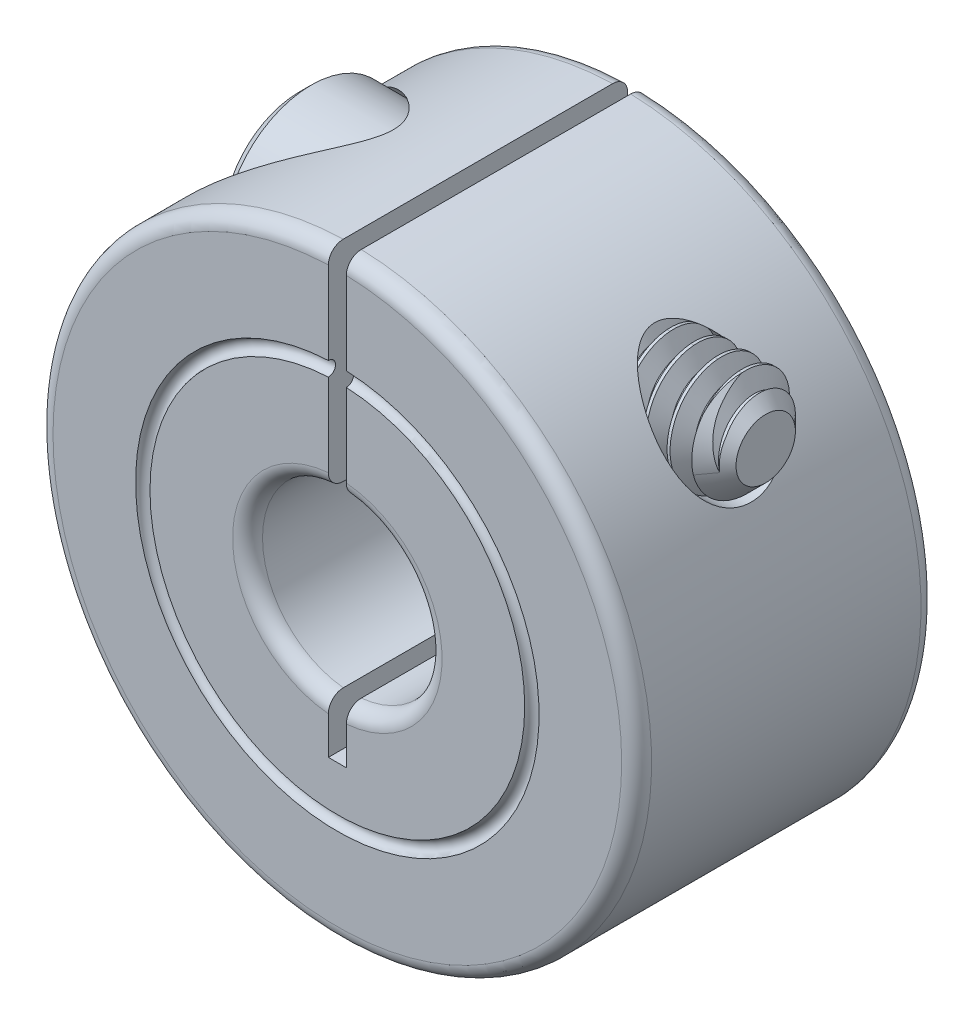
from build123d import *

# Parameters (mm, degrees)
EXTRUDE1_DEPTH     = 3.96875
FILLET1_R          = 0.396875
CUT_EXTRUDE1_DEPTH = 2.38125
CHAMFER1_SIZE      = 0.3175
CHAMFER2_SIZE      = 0.635
CUT_SWEEP1_PITCH   = 0.635


with BuildPart() as part:
    # Sketch1 → Extrude1 (new, symmetric)
    with BuildSketch(Plane.XY):
        with BuildLine():
            Line((-0.238125, 2.369313835), (-0.238125, 7.933927321))
            ThreePointArc((-0.238125, 7.933927321), (0, -7.9375), (0.238125, 7.933927321))
            Line((0.238125, 7.933927321), (0.238125, 2.369313835))
            ThreePointArc((0.238125, 2.369313835), (2.38125, 0), (0.238125, -2.369313835))
            Line((0.238125, -2.369313835), (0.238125, -3.7703125))
            Line((0.238125, -3.7703125), (-0.238125, -3.7703125))
            Line((-0.238125, -3.7703125), (-0.238125, -2.369313835))
            ThreePointArc((-0.238125, -2.369313835), (-2.38125, 0), (-0.238125, 2.369313835))
        make_face()
    extrude(amount=EXTRUDE1_DEPTH, both=True)

    # Fillet1
    fillet1_edges = [part.edges().sort_by_distance(p)[0] for p in [
        (-2.38125, 0, 3.96875),
        (0, -7.9375, 3.96875),
        (2.38125, 0, 3.96875),
        (2.38125, 0, -3.96875),
        (0, -7.9375, -3.96875),
        (-2.38125, 0, -3.96875),
    ]]
    fillet(fillet1_edges, radius=FILLET1_R)

    # Sketch2 → Cut-Revolve1 (revolve, cut)
    with BuildSketch(Plane(origin=(0, 0, 0), x_dir=(1, 0, 0), z_dir=(0, 1, 0))):
        with BuildLine():
            Line((-5.349875, -3.96875), (-4.968875, -3.96875))
            ThreePointArc((-4.968875, -3.96875), (-5.159375, -3.77825), (-5.349875, -3.96875))
        make_face()
    revolve(axis=Axis((0, 0, -3.96875), (0, 0, 1)), mode=Mode.SUBTRACT)

    # Sketch3 → Cut-Revolve2 (revolve, cut)
    with BuildSketch(Plane.XY, mode=Mode.PRIVATE) as cut_revolve2_sk:
        Polygon((7.9375, 5.151620578), (-7.9375, 5.151620578), (-7.9375, 2.764020578), (-2.1336, 2.764020578), (-2.1336, 3.729220578), (7.9375, 3.729220578), align=None)
    revolve(cut_revolve2_sk.sketch.rotate(Axis((-7.9375, 5.151620578, 0), (-1, 0, 0)), 180), axis=Axis((-7.9375, 5.151620578, 0), (-1, 0, 0)), mode=Mode.SUBTRACT)


with BuildPart() as body_2:
    # Sketch4 → Revolve1 (revolve)
    with BuildSketch(Plane.XY):
        Polygon((-4.9784, 5.151620578), (-4.9784, 7.475720578), (-2.1336, 7.475720578), (-2.1336, 6.574020578), (7.3914, 6.574020578), (7.3914, 5.151620578), align=None)
    revolve(axis=Axis((7.3914, 5.151620578, 0), (-1, 0, 0)))

    # Sketch5 → Cut-Extrude1 (cut)
    with BuildSketch(Plane(origin=(-4.9784, 0, 0), x_dir=(0, -1, 0), z_dir=(-1, 0, 0))):
        Polygon((-4.464212914, -1.190625), (-3.776805249, 0), (-4.464212914, 1.190625), (-5.839028242, 1.190625), (-6.526435906, 0), (-5.839028242, -1.190625), align=None)
    extrude(amount=-CUT_EXTRUDE1_DEPTH, mode=Mode.SUBTRACT)

    # Chamfer1
    chamfer1_edges = [body_2.edges().sort_by_distance(p)[0] for p in [
        (-4.9784, 2.827520578, 0),
    ]]
    chamfer(chamfer1_edges, length=CHAMFER1_SIZE)

    # Chamfer2
    chamfer2_edges = [body_2.edges().sort_by_distance(p)[0] for p in [
        (7.3914, 3.729220578, 0),
    ]]
    chamfer(chamfer2_edges, length=CHAMFER2_SIZE)

    # Cut-Sweep1: arcs per turn and ends read off the stored shape
    # Cut-Sweep1: the profile of Sketch7 screwed along a right-hand helix through 15 turns, 6 arcs to a turn; built about Z, then put on its axis
    cut_sweep1_z = Axis((0, 0, 0), (0, 0, 1))
    cut_sweep1_corners = [(1.009955401, -1.76e-07, -0.396875018), (1.009955401, -1.76e-07, -0.476250018), (1.456770383, -2.54e-07, -0.734218768), (1.456770383, -2.54e-07, -0.138906268)]
    with BuildLine(mode=Mode.PRIVATE) as cut_sweep1_profile:
        Line(cut_sweep1_corners[0], cut_sweep1_corners[1])
        Line(cut_sweep1_corners[1], cut_sweep1_corners[2])
        Line(cut_sweep1_corners[2], cut_sweep1_corners[3])
        Line(cut_sweep1_corners[3], cut_sweep1_corners[0])
    cut_sweep1_cap = Face(cut_sweep1_profile.wire())
    cut_sweep1_turn_angles = [0, 30, 60, 90, 120, 150, 180, 210, 240, 270, 300, 330, 360]
    cut_sweep1_turn_weights = [1, 0.8660254037844387, 1, 0.8660254037844387, 1, 0.8660254037844387, 1, 0.8660254037844387, 1, 0.8660254037844387, 1, 0.8660254037844387, 1]
    cut_sweep1_turn_rails = [Edge.make_bspline([Vector(p[0], p[1], 0).rotate(cut_sweep1_z, cut_sweep1_turn_angles[k]) / cut_sweep1_turn_weights[k] + Vector(0, 0, p[2] + CUT_SWEEP1_PITCH * cut_sweep1_turn_angles[k] / 360) for k in range(13)], [0, 0, 0, 1, 1, 2, 2, 3, 3, 4, 4, 5, 5, 6, 6, 6], 2, cut_sweep1_turn_weights) for p in cut_sweep1_corners]
    cut_sweep1_turn_sides = [Face.make_surface_from_curves(cut_sweep1_turn_rails[p[0]], cut_sweep1_turn_rails[p[1]]) for p in [(0, 1), (1, 2), (2, 3), (3, 0)]]
    cut_sweep1 = Plane(origin=(7.3914, 5.151620578, 0), x_dir=(0, 0, 1), z_dir=(-1, 0, 0)) * Solid(Shell([*[p.moved(Location((0, 0, CUT_SWEEP1_PITCH * i))) for i in range(15) for p in cut_sweep1_turn_sides], cut_sweep1_cap, cut_sweep1_cap.rotate(cut_sweep1_z, 5400).moved(Location((0, 0, CUT_SWEEP1_PITCH * 5400 / 360)))]))
    add(cut_sweep1, mode=Mode.SUBTRACT)


solid = Compound([part.part, body_2.part])
